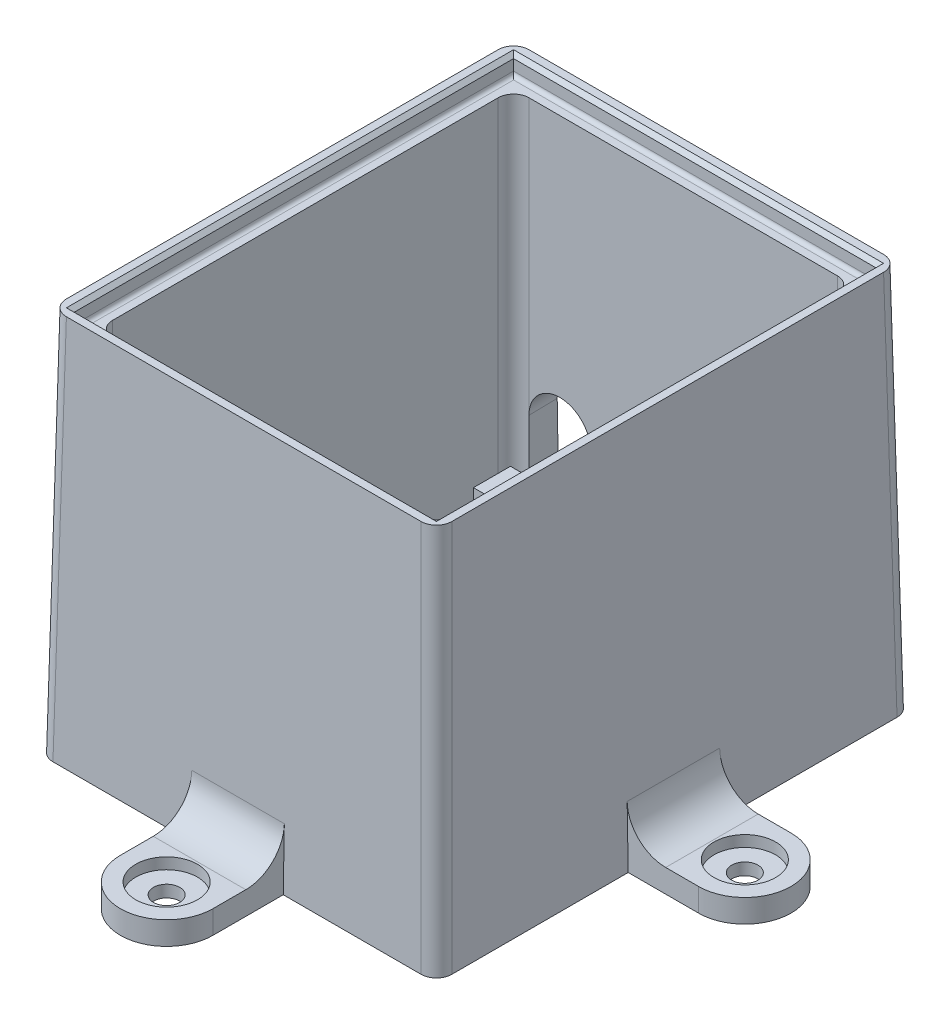
from build123d import *

# Parameters (mm, degrees)
CROQUIS1_W                   = 50
CROQUIS1_H                   = 60
SALIENTE_EXTRUIR1_DEPTH      = 50
VACIADO1_T                   = -3
CROQUIS2_W                   = 12.2
CROQUIS2_H                   = 4.8
CROQUIS2_R                   = 0.9
SALIENTE_EXTRUIR2_DEPTH      = 18.3
CORTAR_EXTRUIR1_REACH        = 71.148
CORTAR_EXTRUIR2_START        = 18.3
CROQUIS2_3_R                 = 0.9
CORTAR_EXTRUIR2_DEPTH        = 8
CORTAR_EXTRUIR3_DEPTH        = 64.442887702
CORTAR_EXTRUIR3_DEPTH_BACK   = 2.4
CROQUIS5_W                   = 47
CROQUIS5_H                   = 57
REDONDEO1_R                  = 0.5
CHAFL_N1_SIZE                = 0.5
SALIENTE_EXTRUIR3_DEPTH      = 3
NGULO_DE_SALIDA5_ANGLE       = 1
REDONDEO3_R                  = 5
TALADROAVANZADO1_START       = 1.55
TALADROAVANZADO1_OUTLINE_R   = 4
TALADROAVANZADO1_DEPTH       = 1.45
TALADROAVANZADO1_2_OUTLINE_R = 1.7
TALADROAVANZADO1_2_DEPTH     = 1.55
NERVIO4_START                = -0.9
NERVIO4_DEPTH                = 1.8
NERVIO5_REACH                = 86.436
CROQUIS16_WALL_W             = 7.071067812
CROQUIS16_WALL_H             = 1.8
CORTAR_EXTRUIR8_DEPTH        = 68.975657408
CORTAR_EXTRUIR8_DEPTH_BACK   = 13
NERVIO9_START                = -3
NERVIO9_OUTLINE_W            = 31.268599093
NERVIO9_OUTLINE_H            = 39.871788568
NERVIO9_DEPTH                = 3
REDONDEO4_R                  = 2
REDONDEO5_R                  = 2
CORTAR_EXTRUIR9_REACH        = 102.177


# Read off the part's stored shape, not the designer's step: TaladroAvanzado1, Nervio4, Nervio9
with BuildPart() as part:
    # Croquis1 → Saliente-Extruir1 (new body)
    with BuildSketch(Plane(origin=(0, 0, 0), x_dir=(1, 0, 0), z_dir=(0, 1, 0))):
        Rectangle(CROQUIS1_W, CROQUIS1_H)
    extrude(amount=SALIENTE_EXTRUIR1_DEPTH)

    # Vaciado1
    vaciado1_openings = [part.faces().sort_by_distance(p)[0] for p in [
        (0, 50, 0),
    ]]
    offset(amount=VACIADO1_T, openings=vaciado1_openings, kind=Kind.INTERSECTION)

    # Croquis2 → Saliente-Extruir2 (add)
    # profile 1 of 2: a face of its own
    with BuildSketch(Plane(origin=(0, 3, 0), x_dir=(1, 0, 0), z_dir=(0, 1, 0))):
        with Locations((0, 8.3)):
            Rectangle(CROQUIS2_W, CROQUIS2_H)
    # profile 2 of 2: a face of its own
    with BuildSketch(Plane(origin=(0, 3, 0), x_dir=(1, 0, 0), z_dir=(0, 1, 0))):
        with Locations((0, -19.4)):
            Rectangle(CROQUIS2_W, CROQUIS2_H)
        with Locations(Location((0, -19.55, 0), (0, 0, 270))):
            Circle(CROQUIS2_R, mode=Mode.SUBTRACT)
    extrude(amount=SALIENTE_EXTRUIR2_DEPTH)

    # Croquis4 → Cortar-Extruir1 (cut, up to next)
    with BuildSketch(Plane(origin=(0, 0, -10.7), x_dir=(-1, 0, 0), z_dir=(0, 0, -1)), mode=Mode.PRIVATE) as cortar_extruir1_sk1:
        with BuildLine():
            Line((-3.7, 3), (3.7, 3))
            Line((3.7, 3), (3.7, 7.5))
            ThreePointArc((3.7, 7.5), (0, 11.2), (-3.7, 7.5))
            Line((-3.7, 7.5), (-3.7, 3))
        make_face()
    cortar_extruir1_tool1 = extrude(cortar_extruir1_sk1.sketch, amount=-CORTAR_EXTRUIR1_REACH, mode=Mode.PRIVATE) & part.part
    add(cortar_extruir1_tool1.solids().sort_by_distance((0, 6.74903, -10.7))[0], mode=Mode.SUBTRACT)

    # Croquis2<3> → Cortar-Extruir2 (cut)
    with BuildSketch(Plane(origin=(0, 3, 0), x_dir=(1, 0, 0), z_dir=(0, 1, 0)).offset(CORTAR_EXTRUIR2_START)):
        with Locations(Location((0, 8.45, 0), (0, 0, 270))):
            Circle(CROQUIS2_3_R)
    extrude(amount=-CORTAR_EXTRUIR2_DEPTH, mode=Mode.SUBTRACT)

    # Croquis5 → Cortar-Extruir3 (cut, two sides: drawn at the far end of the back side and taken through both)
    with BuildSketch(Plane(origin=(0, 50, 0), x_dir=(1, 0, 0), z_dir=(0, 1, 0)).offset(-CORTAR_EXTRUIR3_DEPTH_BACK)):
        Rectangle(CROQUIS5_W, CROQUIS5_H)
    extrude(amount=CORTAR_EXTRUIR3_DEPTH + CORTAR_EXTRUIR3_DEPTH_BACK, mode=Mode.SUBTRACT)

    # Redondeo1
    redondeo1_edges = [part.edges().sort_by_distance(p)[0] for p in [
        (0, 47.6, 28.5),
        (23.5, 47.6, 0),
        (0, 47.6, -28.5),
        (-23.5, 47.6, 0),
    ]]
    fillet(redondeo1_edges, radius=REDONDEO1_R)

    # Chaflán1
    chafl_n1_edges = [part.edges().sort_by_distance(p)[0] for p in [
        (0, 50, 28.5),
        (23.5, 50, 0),
        (0, 50, -28.5),
        (-23.5, 50, 0),
    ]]
    chamfer(chafl_n1_edges, length=CHAFL_N1_SIZE)

    # Croquis11 → Saliente-Extruir3 (add)
    with BuildSketch(Plane.XZ):
        with BuildLine():
            Line((-25, 6), (-35, 6))
            ThreePointArc((-35, 6), (-41, 0), (-35, -6))
            Line((-35, -6), (-25, -6))
            Line((-25, -6), (-25, 6))
        make_face()
        with BuildLine():
            Line((25, 6), (35, 6))
            ThreePointArc((35, 6), (41, 0), (35, -6))
            Line((35, -6), (25, -6))
            Line((25, -6), (25, 6))
        make_face()
        with BuildLine():
            Line((6, -30), (-6, -30))
            Line((-6, -30), (-6, -40))
            ThreePointArc((-6, -40), (0, -46), (6, -40))
            Line((6, -40), (6, -30))
        make_face()
        with BuildLine():
            Line((-6, 30), (6, 30))
            Line((6, 30), (6, 40))
            ThreePointArc((6, 40), (0, 46), (-6, 40))
            Line((-6, 40), (-6, 30))
        make_face()
    extrude(amount=-SALIENTE_EXTRUIR3_DEPTH)

    # Ángulo de salida5
    ngulo_de_salida5_faces = [part.faces().sort_by_distance(p)[0] for p in [
        (25, 25.285425101, 0),
        (0, 25.343344156, 30),
        (-25, 25.285425101, 0),
        (0, 25.343344156, -30),
    ]]
    draft(ngulo_de_salida5_faces, Plane.ZX.offset(50), NGULO_DE_SALIDA5_ANGLE)

    # Redondeo3
    redondeo3_edges = [part.edges().sort_by_distance(p)[0] for p in [
        (-25.820388052, 3, 0),
        (25.820388052, 3, 0),
        (0, 3, -30.820388052),
        (0, 3, 30.820388052),
    ]]
    fillet(redondeo3_edges, radius=REDONDEO3_R)

    # TaladroAvanzado1 outline → TaladroAvanzado1 (cut)
    with BuildSketch(Plane(origin=(0, 0, 0), x_dir=(1, 0, 0), z_dir=(0, 1, 0)).offset(TALADROAVANZADO1_START)):
        with Locations((0, -40)):
            Circle(TALADROAVANZADO1_OUTLINE_R)
        with Locations((0, 40)):
            Circle(TALADROAVANZADO1_OUTLINE_R)
        with Locations((-35, 0)):
            Circle(TALADROAVANZADO1_OUTLINE_R)
        with Locations((35, 0)):
            Circle(TALADROAVANZADO1_OUTLINE_R)
    extrude(amount=TALADROAVANZADO1_DEPTH, mode=Mode.SUBTRACT)

    # TaladroAvanzado1 2 outline → TaladroAvanzado1 2 (cut)
    with BuildSketch(Plane(origin=(0, 0, 0), x_dir=(1, 0, 0), z_dir=(0, 1, 0))):
        with Locations((0, -40)):
            Circle(TALADROAVANZADO1_2_OUTLINE_R)
        with Locations((0, 40)):
            Circle(TALADROAVANZADO1_2_OUTLINE_R)
        with Locations((-35, 0)):
            Circle(TALADROAVANZADO1_2_OUTLINE_R)
        with Locations((35, 0)):
            Circle(TALADROAVANZADO1_2_OUTLINE_R)
    extrude(amount=TALADROAVANZADO1_2_DEPTH, mode=Mode.SUBTRACT)

    # Nervio4 outline → Nervio4 (add)
    with BuildSketch(Plane(origin=(0, 0, 19.4), x_dir=(-1, 0, 0), z_dir=(0, 0, -1)).offset(NERVIO4_START)):
        Polygon((11.1, 3), (6.1, 8), (6.1, 3), align=None)
    nervio4 = extrude(amount=NERVIO4_DEPTH)

    # Simetría1: Nervio4 across plane
    add(nervio4.mirror(Plane(origin=(0, 0, 0), x_dir=(0, 0, 1), z_dir=(1, 0, 0))))

    # Croquis16 wall → Nervio5 (add, up to next)
    with BuildSketch(Plane(origin=(-8.6, 5.5, -8.3), x_dir=(-0.707106781187, -0.707106781187, 0), z_dir=(-0.707106781187, 0.707106781187, 0)), mode=Mode.PRIVATE) as nervio5_sk1:
        Rectangle(CROQUIS16_WALL_W, CROQUIS16_WALL_H)
    nervio5_tool1 = extrude(nervio5_sk1.sketch, amount=-NERVIO5_REACH, mode=Mode.PRIVATE) - part.part
    nervio5 = nervio5_tool1.solids().sort_by_distance((-8.6, 5.5, -8.3))[0]
    add(nervio5)

    # Simetría2: Nervio5 across plane
    add(nervio5.mirror(Plane(origin=(0, 0, 0), x_dir=(0, 0, 1), z_dir=(1, 0, 0))))

    # Croquis17 → Cortar-Extruir8 (cut, two sides: drawn at the far end of the back side and taken through both)
    with BuildSketch(Plane(origin=(0, 21.3, 0), x_dir=(1, 0, 0), z_dir=(0, 1, 0)).offset(-CORTAR_EXTRUIR8_DEPTH_BACK)):
        with BuildLine():
            ThreePointArc((3.512549094, 5.9), (0, 6.52196544), (-3.512549094, 5.9))
            Line((-3.512549094, 5.9), (3.512549094, 5.9))
        make_face()
    extrude(amount=CORTAR_EXTRUIR8_DEPTH + CORTAR_EXTRUIR8_DEPTH_BACK, mode=Mode.SUBTRACT)

    # Nervio9 outline → Nervio9 (add)
    with BuildSketch(Plane(origin=(0, 6, 0), x_dir=(1, 0, 0), z_dir=(0, 1, 0)).offset(NERVIO9_START)):
        Polygon((-22, -12.74799793), (-18.968599093, -12.74799793), (-18.968599093, -23.546859472), (-22, -23.546859472), (-22, -25.346859472), (14.1, -25.346859472), (14.1, -27), (15.9, -27), (15.9, -25.346859472), (22, -25.346859472), (22, -23.546859472), (15.9, -23.546859472), (15.9, -13.648622413), (22, -13.648622413), (22, -11.848622413), (15.9, -11.848622413), (15.9, -7.199306775), (22, -7.199306775), (22, -5.399306775), (15.9, -5.399306775), (15.9, -0.9), (22, -0.9), (22, 0.9), (15.9, 0.9), (15.9, 7.38606859), (22, 7.38606859), (22, 9.18606859), (15.9, 9.18606859), (15.9, 16.324929096), (22, 16.324929096), (22, 18.124929096), (15.9, 18.124929096), (15.9, 27), (14.1, 27), (14.1, 18.124929096), (5.7899715, 18.124929096), (5.7899715, 27), (3.9899715, 27), (3.9899715, 18.124929096), (-7.13941805, 18.124929096), (-7.13941805, 27), (-8.93941805, 27), (-8.93941805, 18.124929096), (-17.168599093, 18.124929096), (-17.168599093, 27), (-18.968599093, 27), (-18.968599093, 9.18606859), (-22, 9.18606859), (-22, 7.38606859), (-18.968599093, 7.38606859), (-18.968599093, 0.9), (-22, 0.9), (-22, -0.9), (-18.968599093, -0.9), (-18.968599093, -5.399306775), (-22, -5.399306775), (-22, -7.199306775), (-18.968599093, -7.199306775), (-18.968599093, -10.94799793), (-22, -10.94799793), align=None)
        with Locations((-1.534299546, -3.610965188)):
            Rectangle(NERVIO9_OUTLINE_W, NERVIO9_OUTLINE_H, mode=Mode.SUBTRACT)
    extrude(amount=NERVIO9_DEPTH)

    # Redondeo4
    redondeo4_edges = [part.edges().sort_by_distance(p)[0] for p in [
        (25.436376623, 25, 30.436376623),
        (-25.436376623, 25, 30.436376623),
        (-25.436376623, 25, -30.436376623),
        (25.436376623, 25, -30.436376623),
    ]]
    fillet(redondeo4_edges, radius=REDONDEO4_R)

    # Redondeo5
    redondeo5_edges = [part.edges().sort_by_distance(p)[0] for p in [
        (-22, 25.3, 27),
        (-22, 25.3, -27),
        (22, 25.3, -27),
        (22, 25.3, 27),
    ]]
    fillet(redondeo5_edges, radius=REDONDEO5_R)

    # Cortar-Extruir9: up to this plane
    cortar_extruir9_end = Plane(origin=(-25, 50, -27), z_dir=(0, 0, 1))
    # Croquis21 → Cortar-Extruir9 (cut, up to the surface)
    with BuildSketch(Plane(origin=(0, 0.538721775, -30.863349823), x_dir=(-1, 0, 0), z_dir=(0, 0.01745240643728355, -0.9998476951563913)), mode=Mode.PRIVATE) as cortar_extruir9_sk1:
        with BuildLine():
            Line((12, 5.461196163), (20, 5.461196163))
            Line((20, 5.461196163), (20, 11.461196163))
            ThreePointArc((20, 11.461196163), (16, 15.461196163), (12, 11.461196163))
            Line((12, 11.461196163), (12, 5.461196163))
        make_face()
    cortar_extruir9_tool1 = split(extrude(cortar_extruir9_sk1.sketch, amount=-CORTAR_EXTRUIR9_REACH, mode=Mode.PRIVATE), bisect_by=cortar_extruir9_end, keep=Keep.BOTH, mode=Mode.PRIVATE)
    add(cortar_extruir9_tool1.solids().sort_by_distance((-16, 10.612775, -30.687507))[0], mode=Mode.SUBTRACT)


solid = part.part
